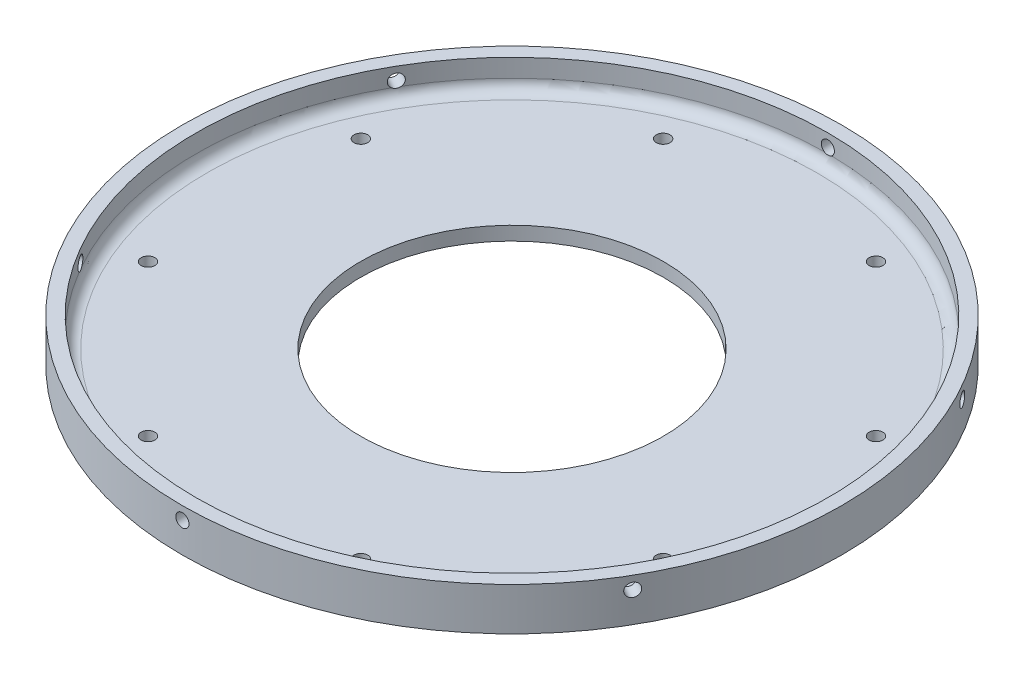
from build123d import *

# Parameters (mm, degrees)
FILLET1_R                    = 2.54
SKETCH10_W                   = 1.524
SKETCH10_H                   = 104.091135768
CIRPATTERN1_COUNT            = 6
F_1_8_0_125_DIAMETER_HOLE1_D = 3.175


with BuildPart() as part:
    # Sketch5 → Revolve1 (revolve)
    with BuildSketch(Plane.XY):
        Polygon((-35, 0), (-76.2, 0), (-76.2, 9.9), (-73.025, 9.9), (-73.025, 3.175), (-35, 3.175), align=None)
    revolve(axis=Axis((0, -81.091216216, 0), (0, 1, 0)))

    # Fillet1
    fillet1_edges = [part.edges().sort_by_distance(p)[0] for p in [
        (73.025, 3.175, 0),
    ]]
    fillet(fillet1_edges, radius=FILLET1_R)

    # Sketch10 → #31 (0.12) Diameter Hole1 (revolve, cut)
    with BuildSketch(Plane(origin=(0.010273242, 6.985, 0), x_dir=(0, 1, 0), z_dir=(1, 0, 0))):
        with Locations((0.762, 52.045567884)):
            Rectangle(SKETCH10_W, SKETCH10_H)
    f_31_0_12_diameter_hole1 = revolve(axis=Axis((0.010273242, 6.985, -6.35), (0, 0, 1)), mode=Mode.SUBTRACT)

    # CirPattern1: #31 (0.12) Diameter Hole1 ×6 about axis
    cirpattern1_axis = Axis((0, -81.091216216, 0), (0, -1, 0))
    for i in range(1, CIRPATTERN1_COUNT):
        add(f_31_0_12_diameter_hole1.rotate(cirpattern1_axis, i * 360 / CIRPATTERN1_COUNT), mode=Mode.SUBTRACT)

    # 1/8 (0.125) Diameter Hole1 (through all)
    with Locations(Plane.XZ):
        with Locations((-24.6, -59.525), (24.6, -59.525), (-59.525, -24.6), (-59.525, 24.6), (-24.6, 59.525), (24.6, 59.525), (59.525, 24.6), (59.525, -24.6)):
            Hole(F_1_8_0_125_DIAMETER_HOLE1_D / 2)


solid = part.part
